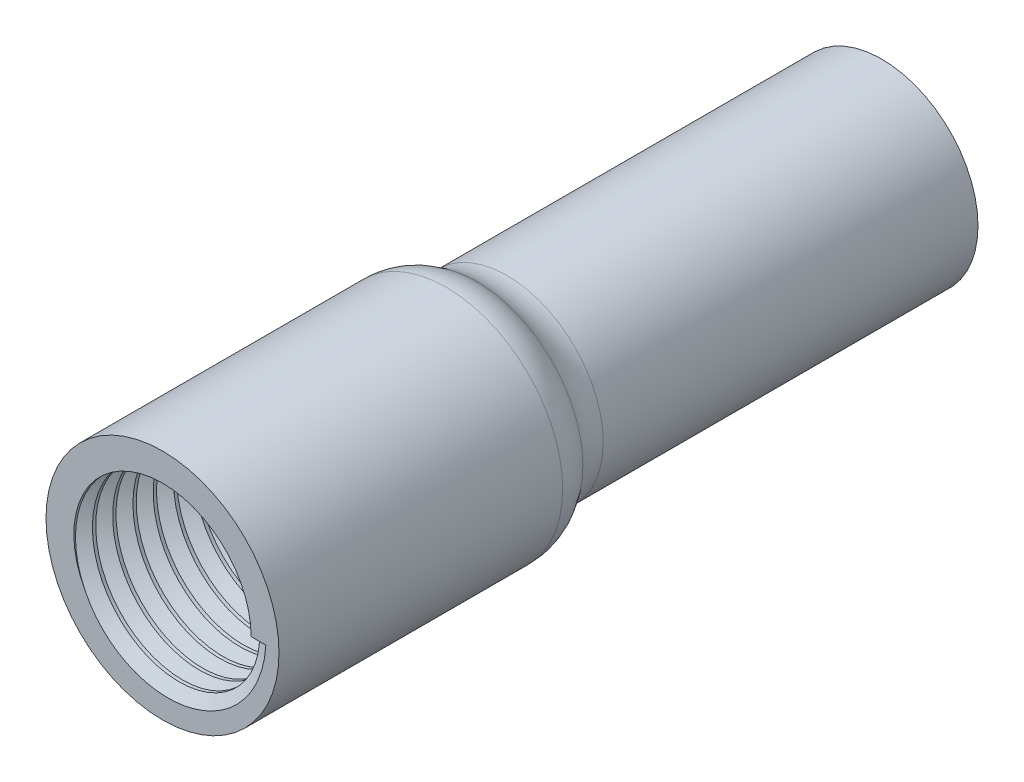
from build123d import *

# Parameters (mm, degrees)
SKETCH1_R                = 9.5
SKETCH1_R_2              = 6.5
BOSS_EXTRUDE1_DEPTH      = 51
BOSS_EXTRUDE2_DEPTH      = 20
BOSS_EXTRUDE2_DEPTH_BACK = 10
SKETCH6_R                = 11.5
SKETCH6_R_2              = 8.75
CUT_SWEEP4_PITCH         = 2
FILLET2_R                = 5
FILLET3_R                = 5


with BuildPart() as part:
    # Sketch1 → Boss-Extrude1 (new body)
    with BuildSketch(Plane.XY):
        Circle(SKETCH1_R)
        Circle(SKETCH1_R_2, mode=Mode.SUBTRACT)
    extrude(amount=BOSS_EXTRUDE1_DEPTH)

    # Sketch6 → Boss-Extrude2 (add, two sides: drawn at the far end of the back side and taken through both)
    with BuildSketch(Plane.XY.offset(51).offset(-BOSS_EXTRUDE2_DEPTH_BACK)):
        Circle(SKETCH6_R)
        Circle(SKETCH6_R_2, mode=Mode.SUBTRACT)
    extrude(amount=BOSS_EXTRUDE2_DEPTH + BOSS_EXTRUDE2_DEPTH_BACK)

    # Cut-Sweep4: the profile of Sketch5 screwed along a right-hand helix of 10 turns, 10 arcs to a turn; built about Z, then put on its axis
    cut_sweep4_z = Axis((0, 0, 0), (0, 0, 1))
    cut_sweep4_corners = [(7.77, 0, 1.402961154), (7.77, 0, -1.402961154), (10.2, 0, 0)]
    with BuildLine(mode=Mode.PRIVATE) as cut_sweep4_profile:
        Line(cut_sweep4_corners[0], cut_sweep4_corners[1])
        Line(cut_sweep4_corners[1], cut_sweep4_corners[2])
        Line(cut_sweep4_corners[2], cut_sweep4_corners[0])
    cut_sweep4_cap = Face(cut_sweep4_profile.wire())
    cut_sweep4_turn_angles = [0, 18, 36, 54, 72, 90, 108, 126, 144, 162, 180, 198, 216, 234, 252, 270, 288, 306, 324, 342, 360]
    cut_sweep4_turn_weights = [1, 0.9510565162951535, 1, 0.9510565162951535, 1, 0.9510565162951535, 1, 0.9510565162951535, 1, 0.9510565162951535, 1, 0.9510565162951535, 1, 0.9510565162951535, 1, 0.9510565162951535, 1, 0.9510565162951535, 1, 0.9510565162951535, 1]
    cut_sweep4_turn_rails = [Edge.make_bspline([Vector(p[0], p[1], 0).rotate(cut_sweep4_z, cut_sweep4_turn_angles[k]) / cut_sweep4_turn_weights[k] + Vector(0, 0, p[2] + CUT_SWEEP4_PITCH * cut_sweep4_turn_angles[k] / 360) for k in range(21)], [0, 0, 0, 1, 1, 2, 2, 3, 3, 4, 4, 5, 5, 6, 6, 7, 7, 8, 8, 9, 9, 10, 10, 10], 2, cut_sweep4_turn_weights) for p in cut_sweep4_corners]
    cut_sweep4_turn_sides = [Face.make_surface_from_curves(cut_sweep4_turn_rails[p[0]], cut_sweep4_turn_rails[p[1]]) for p in [(0, 1), (1, 2), (2, 0)]]
    cut_sweep4 = Plane(origin=(0, 0, 71), x_dir=(1, 0, 0), z_dir=(0, 0, -1)) * Solid(Shell([*[p.moved(Location((0, 0, CUT_SWEEP4_PITCH * i))) for i in range(10) for p in cut_sweep4_turn_sides], cut_sweep4_cap, cut_sweep4_cap.rotate(cut_sweep4_z, 3600).moved(Location((0, 0, CUT_SWEEP4_PITCH * 3600 / 360)))]))
    add(cut_sweep4, mode=Mode.SUBTRACT)

    # Fillet2
    # the kernel refuses this fillet: 5 mm, written as the material it adds along each edge
    with BuildSketch(Plane(origin=(0, 0, 41), x_dir=(1, 0, 0), z_dir=(0, 1, 0))) as fillet2_piece_1:
        with BuildLine():
            CenterArc((14.5, 4), FILLET2_R, 180, 53.130102354)
            Line((11.5, 0), (11.44, -0.08))
            ThreePointArc((11.44, -0.08), (10.5, -0.1), (9.5, -0.1))
            Line((9.5, -0.1), (9.4, 0))
            Line((9.4, 0), (9.4, 4))
            Line((9.4, 4), (9.5, 4))
        make_face()
    revolve(axis=Axis((0, 0, 41), (0, 0, -1)))

    # Fillet3
    fillet3_edges = [part.edges().sort_by_distance(p)[0] for p in [
        (-11.5, 0, 41),
    ]]
    fillet(fillet3_edges, radius=FILLET3_R)


solid = part.part
